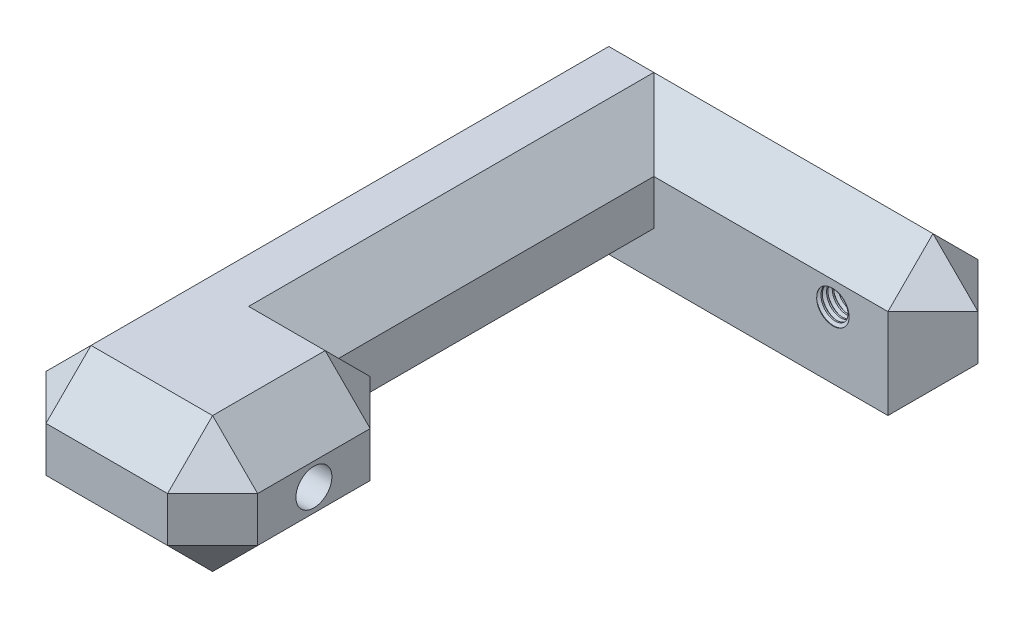
from build123d import *

# Parameters (mm, degrees)
MAIN_BODY_DEPTH    = 15
SKETCH3_R          = 7
CUT_EXTRUDE1_DEPTH = 40
SKETCH4_R          = 4
CUT_EXTRUDE2_DEPTH = 165.05486887
SKETCH6_R          = 3.31
CUT_EXTRUDE3_DEPTH = 144.732390226
THREAD1_PITCH      = 1.25


with BuildPart() as part:
    # Sketch1 → Main Body (new, symmetric)
    with BuildSketch(Plane(origin=(0, 0, 0), x_dir=(1, 0, 0), z_dir=(0, 1, 0))):
        Polygon((0, 0), (0, 45), (-17, 45), (-17, 115), (45, 115), (45, 135), (-47, 135), (-47, 0), align=None)
    extrude(amount=MAIN_BODY_DEPTH, both=True)

    # Sketch3 → Cut-Extrude1 (cut)
    with BuildSketch(Plane.ZY.offset(47)):
        with Locations((-22.5, 0)):
            Circle(SKETCH3_R)
    extrude(amount=-CUT_EXTRUDE1_DEPTH, mode=Mode.SUBTRACT)

    # Sketch4 → Cut-Extrude2 (cut, through all)
    with BuildSketch(Plane.ZY.offset(47)):
        with Locations((-22.5, 0)):
            Circle(SKETCH4_R)
    extrude(amount=-CUT_EXTRUDE2_DEPTH, mode=Mode.SUBTRACT)

    # Sketch6 → Cut-Extrude3 (cut, through all)
    with BuildSketch(Plane(origin=(0, 0, -135), x_dir=(-1, 0, 0), z_dir=(0, 0, -1))):
        with Locations((-22.5, 0)):
            Circle(SKETCH6_R)
    extrude(amount=-CUT_EXTRUDE3_DEPTH, mode=Mode.SUBTRACT)

    # Thread1: the profile of Thread Profile3 profile screwed along a right-hand helix of 17 turns, 8 arcs to a turn; built about Z, then put on its axis
    thread1_z = Axis((0, 0, 0), (0, 0, 1))
    thread1_corners = [(3.3097, 0, -0.000173205), (3.986582344, 0, 0.390624998), (3.986582344, 0, 0.546874998), (3.3097, 0, 0.937673202)]
    with BuildLine(mode=Mode.PRIVATE) as thread1_profile:
        Line(thread1_corners[0], thread1_corners[1])
        Line(thread1_corners[1], thread1_corners[2])
        Line(thread1_corners[2], thread1_corners[3])
        Line(thread1_corners[3], thread1_corners[0])
    thread1_cap = Face(thread1_profile.wire())
    thread1_turn_angles = [0, 22.5, 45, 67.5, 90, 112.5, 135, 157.5, 180, 202.5, 225, 247.5, 270, 292.5, 315, 337.5, 360]
    thread1_turn_weights = [1, 0.9238795325112867, 1, 0.9238795325112867, 1, 0.9238795325112867, 1, 0.9238795325112867, 1, 0.9238795325112867, 1, 0.9238795325112867, 1, 0.9238795325112867, 1, 0.9238795325112867, 1]
    thread1_turn_rails = [Edge.make_bspline([Vector(p[0], p[1], 0).rotate(thread1_z, thread1_turn_angles[k]) / thread1_turn_weights[k] + Vector(0, 0, p[2] + THREAD1_PITCH * thread1_turn_angles[k] / 360) for k in range(17)], [0, 0, 0, 1, 1, 2, 2, 3, 3, 4, 4, 5, 5, 6, 6, 7, 7, 8, 8, 8], 2, thread1_turn_weights) for p in thread1_corners]
    thread1_turn_sides = [Face.make_surface_from_curves(thread1_turn_rails[p[0]], thread1_turn_rails[p[1]]) for p in [(0, 1), (1, 2), (2, 3), (3, 0)]]
    thread1 = Plane(origin=(22.5, 0, -113.75), x_dir=(-1, 0, 0), z_dir=(0, 0, -1)) * Solid(Shell([*[p.moved(Location((0, 0, THREAD1_PITCH * i))) for i in range(17) for p in thread1_turn_sides], thread1_cap, thread1_cap.rotate(thread1_z, 6120).moved(Location((0, 0, THREAD1_PITCH * 6120 / 360)))]))
    add(thread1, mode=Mode.SUBTRACT)

    # Chamfer1
    # the kernel refuses this chamfer: 10 mm, written as the material it takes off along each edge
    with BuildSketch(Plane(origin=(-6.666666667, -8.333333333, -38.333333333), x_dir=(-0.7071067811865475, -0.7071067811865475, 0), z_dir=(0.5773502691896257, -0.5773502691896257, -0.5773502691896257)), Plane(origin=(-40.333333333, -8.333333333, -6.666666667), x_dir=(0, 0.7071067811865472, 0.7071067811865477), z_dir=(-0.5773502691896258, -0.577350269189626, 0.5773502691896255)), Plane(origin=(-6.666666667, 8.333333333, -38.333333333), x_dir=(-0.7071067811865475, 0, -0.7071067811865475), z_dir=(0.5773502691896257, 0.5773502691896257, -0.5773502691896257)), Plane(origin=(-40.333333333, 8.333333333, -128.333333333), x_dir=(-0.7071067811865475, 0, 0.7071067811865475), z_dir=(-0.5773502691896257, 0.5773502691896257, -0.5773502691896257)), Plane(origin=(38.333333333, 8.333333333, -128.333333333), x_dir=(-0.7071067811865475, 0, -0.7071067811865475), z_dir=(0.5773502691896257, 0.5773502691896257, -0.5773502691896257)), Plane(origin=(38.333333333, 8.333333333, -121.666666667), x_dir=(-0.7071067811865475, 0.7071067811865475, 0), z_dir=(0.5773502691896257, 0.5773502691896257, 0.5773502691896257))) as chamfer1_piece_1:
        Polygon((-7.071067812, -4.082482905), (7.071067812, -4.082482905), (0, 8.164965809), align=None)
    extrude(amount=12.701705922, mode=Mode.SUBTRACT)
    with BuildSketch(Plane(origin=(-6.666666667, -8.333333333, -6.666666667), x_dir=(-0.7071067811865475, -0.7071067811865475, 0), z_dir=(0.5773502691896257, -0.5773502691896257, 0.5773502691896257)), Plane(origin=(-40.333333333, 8.333333333, -6.666666667), x_dir=(-0.7071067811865475, 0, -0.7071067811865477), z_dir=(-0.5773502691896258, 0.5773502691896258, 0.5773502691896257)), Plane(origin=(-6.666666667, 8.333333333, -6.666666667), x_dir=(-0.7071067811865475, 0, 0.7071067811865475), z_dir=(0.5773502691896257, 0.5773502691896257, 0.5773502691896257))) as chamfer1_piece_2:
        Polygon((-7.071067812, 4.082482905), (7.071067812, 4.082482905), (0, -8.164965809), align=None)
    extrude(amount=12.701705922, mode=Mode.SUBTRACT)
    with BuildSketch(Plane(origin=(-17, -15, -45), x_dir=(-0.9996219169112968, -0.027495876610586317, 0), z_dir=(0, 0, -1))) as chamfer1_piece_3:
        with BuildLine():
            Line((10.286731952, 0), (-0.565471549, 10.271177935))
            Line((-0.565471549, 10.271177935), (-0.765395932, 10.26567876))
            ThreePointArc((-0.765395932, 10.26567876), (-0.341292271, 5.133978296), (-0.199924383, -0.005499175))
            Line((-0.199924383, -0.005499175), (0.005499175, -0.199924383))
            ThreePointArc((0.005499175, -0.199924383), (5.144976647, -0.058556496), (10.292231127, -0.199924383))
            Line((10.292231127, -0.199924383), (10.286731952, 0))
        make_face()
    extrude(amount=70, mode=Mode.SUBTRACT)
    with BuildSketch(Plane(origin=(25.71682988, -15, -45), x_dir=(0, -0.027495876610586317, 0.9996219169112968), z_dir=(-1, 0, 0)), Plane(origin=(25.71682988, 15, -45), x_dir=(0, -0.9996219169112968, -0.027495876610586317), z_dir=(-1, 0, 0))) as chamfer1_piece_4:
        with BuildLine():
            Line((10.286731952, 0), (-0.565471549, 10.271177935))
            Line((-0.565471549, 10.271177935), (-0.765395932, 10.26567876))
            ThreePointArc((-0.765395932, 10.26567876), (-0.341292271, 5.133978296), (-0.199924383, -0.005499175))
            Line((-0.199924383, -0.005499175), (0.005499175, -0.199924383))
            ThreePointArc((0.005499175, -0.199924383), (5.144976647, -0.058556496), (10.292231127, -0.199924383))
            Line((10.292231127, -0.199924383), (10.286731952, 0))
        make_face()
    extrude(amount=42.71682988, mode=Mode.SUBTRACT)
    with BuildSketch(Plane(origin=(0, -15, 25.71682988), x_dir=(0.027495876610586372, 0.9996219169112968, 0), z_dir=(0, 0, -1))) as chamfer1_piece_5:
        with BuildLine():
            Line((10.286731952, 0), (-0.565471549, -10.271177935))
            Line((-0.565471549, -10.271177935), (-0.765395932, -10.26567876))
            ThreePointArc((-0.765395932, -10.26567876), (-0.341292271, -5.133978296), (-0.199924383, 0.005499175))
            Line((-0.199924383, 0.005499175), (0.005499175, 0.199924383))
            ThreePointArc((0.005499175, 0.199924383), (5.144976647, 0.058556496), (10.292231127, 0.199924383))
            Line((10.292231127, 0.199924383), (10.286731952, 0))
        make_face()
    extrude(amount=96.433659759, mode=Mode.SUBTRACT)
    with BuildSketch(Plane(origin=(-72.71682988, -15, 0), x_dir=(0, -0.027495876610586317, -0.9996219169112968), z_dir=(1, 0, 0)), Plane(origin=(-72.71682988, 15, 0), x_dir=(0, -0.9996219169112968, 0.027495876610586365), z_dir=(1, 0, 0))) as chamfer1_piece_6:
        with BuildLine():
            Line((10.286731952, 0), (-0.565471549, 10.271177935))
            Line((-0.565471549, 10.271177935), (-0.765395932, 10.26567876))
            ThreePointArc((-0.765395932, 10.26567876), (-0.341292271, 5.133978296), (-0.199924383, -0.005499175))
            Line((-0.199924383, -0.005499175), (0.005499175, -0.199924383))
            ThreePointArc((0.005499175, -0.199924383), (5.144976647, -0.058556496), (10.292231127, -0.199924383))
            Line((10.292231127, -0.199924383), (10.286731952, 0))
        make_face()
    extrude(amount=98.433659759, mode=Mode.SUBTRACT)
    with BuildSketch(Plane(origin=(-47, 40.71682988, 0), x_dir=(0.9996219169112968, 0, 0.027495876610586258), z_dir=(0, -1, 0)), Plane(origin=(45, -40.71682988, -135), x_dir=(0.027495876610586317, 0, 0.9996219169112968), z_dir=(0, 1, 0)), Plane(origin=(45, -40.71682988, -115), x_dir=(-0.9996219169112968, 0, 0.027495876610586317), z_dir=(0, 1, 0)), Plane(origin=(0, -40.71682988, -45), x_dir=(0.027495876610586372, 0, 0.9996219169112968), z_dir=(0, 1, 0)), Plane(origin=(0, 40.71682988, 0), x_dir=(0.027495876610586372, 0, -0.9996219169112968), z_dir=(0, -1, 0))) as chamfer1_piece_7:
        with BuildLine():
            Line((10.286731952, 0), (-0.565471549, -10.271177935))
            Line((-0.565471549, -10.271177935), (-0.765395932, -10.26567876))
            ThreePointArc((-0.765395932, -10.26567876), (-0.341292271, -5.133978296), (-0.199924383, 0.005499175))
            Line((-0.199924383, 0.005499175), (0.005499175, 0.199924383))
            ThreePointArc((0.005499175, 0.199924383), (5.144976647, 0.058556496), (10.292231127, 0.199924383))
            Line((10.292231127, 0.199924383), (10.286731952, 0))
        make_face()
    extrude(amount=81.433659759, mode=Mode.SUBTRACT)
    with BuildSketch(Plane(origin=(-47, 40.71682988, -135), x_dir=(0.9996219169112968, 0, -0.0274958766105877), z_dir=(0, -1, 0))) as chamfer1_piece_8:
        with BuildLine():
            Line((10.286731952, 0), (-0.565471549, 10.271177935))
            Line((-0.565471549, 10.271177935), (-0.765395932, 10.26567876))
            ThreePointArc((-0.765395932, 10.26567876), (-0.341292271, 5.133978296), (-0.199924383, -0.005499175))
            Line((-0.199924383, -0.005499175), (0.005499175, -0.199924383))
            ThreePointArc((0.005499175, -0.199924383), (5.144976647, -0.058556496), (10.292231127, -0.199924383))
            Line((10.292231127, -0.199924383), (10.286731952, 0))
        make_face()
    extrude(amount=81.433659759, mode=Mode.SUBTRACT)
    with BuildSketch(Plane(origin=(-17, 15, -45), x_dir=(-0.9996219169112968, 0.027495876610586317, 0), z_dir=(0, 0, -1))) as chamfer1_piece_9:
        with BuildLine():
            Line((10.286731952, 0), (-0.565471549, -10.271177935))
            Line((-0.565471549, -10.271177935), (-0.765395932, -10.26567876))
            ThreePointArc((-0.765395932, -10.26567876), (-0.341292271, -5.133978296), (-0.199924383, 0.005499175))
            Line((-0.199924383, 0.005499175), (0.005499175, 0.199924383))
            ThreePointArc((0.005499175, 0.199924383), (5.144976647, 0.058556496), (10.292231127, 0.199924383))
            Line((10.292231127, 0.199924383), (10.286731952, 0))
        make_face()
    extrude(amount=70, mode=Mode.SUBTRACT)
    with BuildSketch(Plane(origin=(-17, 15, -115), x_dir=(0, 0.027495876610586317, -0.9996219169112968), z_dir=(1, 0, 0))) as chamfer1_piece_10:
        with BuildLine():
            Line((10.286731952, 0), (-0.565471549, -10.271177935))
            Line((-0.565471549, -10.271177935), (-0.765395932, -10.26567876))
            ThreePointArc((-0.765395932, -10.26567876), (-0.341292271, -5.133978296), (-0.199924383, 0.005499175))
            Line((-0.199924383, 0.005499175), (0.005499175, 0.199924383))
            ThreePointArc((0.005499175, 0.199924383), (5.144976647, 0.058556496), (10.292231127, 0.199924383))
            Line((10.292231127, 0.199924383), (10.286731952, 0))
        make_face()
    extrude(amount=87.71682988, mode=Mode.SUBTRACT)
    with BuildSketch(Plane(origin=(45, 15, -89.28317012), x_dir=(-0.9996219169112968, 0.027495876610586317, 0), z_dir=(0, 0, -1))) as chamfer1_piece_11:
        with BuildLine():
            Line((10.286731952, 0), (-0.565471549, -10.271177935))
            Line((-0.565471549, -10.271177935), (-0.765395932, -10.26567876))
            ThreePointArc((-0.765395932, -10.26567876), (-0.341292271, -5.133978296), (-0.199924383, 0.005499175))
            Line((-0.199924383, 0.005499175), (0.005499175, 0.199924383))
            ThreePointArc((0.005499175, 0.199924383), (5.144976647, 0.058556496), (10.292231127, 0.199924383))
            Line((10.292231127, 0.199924383), (10.286731952, 0))
        make_face()
    extrude(amount=71.433659759, mode=Mode.SUBTRACT)
    with BuildSketch(Plane(origin=(70.71682988, 15, -135), x_dir=(0, 0.027495876610586317, 0.9996219169112968), z_dir=(-1, 0, 0))) as chamfer1_piece_12:
        with BuildLine():
            Line((10.286731952, 0), (-0.565471549, -10.271177935))
            Line((-0.565471549, -10.271177935), (-0.765395932, -10.26567876))
            ThreePointArc((-0.765395932, -10.26567876), (-0.341292271, -5.133978296), (-0.199924383, 0.005499175))
            Line((-0.199924383, 0.005499175), (0.005499175, 0.199924383))
            ThreePointArc((0.005499175, 0.199924383), (5.144976647, 0.058556496), (10.292231127, 0.199924383))
            Line((10.292231127, 0.199924383), (10.286731952, 0))
        make_face()
    extrude(amount=143.433659759, mode=Mode.SUBTRACT)
    with BuildSketch(Plane(origin=(-47, 15, -160.71682988), x_dir=(0.9996219169112968, 0.027495876610586317, 0), z_dir=(0, 0, 1))) as chamfer1_piece_13:
        with BuildLine():
            Line((10.286731952, 0), (-0.565471549, -10.271177935))
            Line((-0.565471549, -10.271177935), (-0.765395932, -10.26567876))
            ThreePointArc((-0.765395932, -10.26567876), (-0.341292271, -5.133978296), (-0.199924383, 0.005499175))
            Line((-0.199924383, 0.005499175), (0.005499175, 0.199924383))
            ThreePointArc((0.005499175, 0.199924383), (5.144976647, 0.058556496), (10.292231127, 0.199924383))
            Line((10.292231127, 0.199924383), (10.286731952, 0))
        make_face()
    extrude(amount=186.433659759, mode=Mode.SUBTRACT)
    with BuildSketch(Plane(origin=(-47, -15, -160.71682988), x_dir=(0.9996219169112968, -0.027495876610586317, 0), z_dir=(0, 0, 1))) as chamfer1_piece_14:
        with BuildLine():
            Line((10.286731952, 0), (-0.565471549, 10.271177935))
            Line((-0.565471549, 10.271177935), (-0.765395932, 10.26567876))
            ThreePointArc((-0.765395932, 10.26567876), (-0.341292271, 5.133978296), (-0.199924383, -0.005499175))
            Line((-0.199924383, -0.005499175), (0.005499175, -0.199924383))
            ThreePointArc((0.005499175, -0.199924383), (5.144976647, -0.058556496), (10.292231127, -0.199924383))
            Line((10.292231127, -0.199924383), (10.286731952, 0))
        make_face()
    extrude(amount=186.433659759, mode=Mode.SUBTRACT)
    with BuildSketch(Plane(origin=(0, 15, 25.71682988), x_dir=(0.027495876610586372, -0.9996219169112968, 0), z_dir=(0, 0, -1))) as chamfer1_piece_15:
        with BuildLine():
            Line((10.286731952, 0), (-0.565471549, 10.271177935))
            Line((-0.565471549, 10.271177935), (-0.765395932, 10.26567876))
            ThreePointArc((-0.765395932, 10.26567876), (-0.341292271, 5.133978296), (-0.199924383, -0.005499175))
            Line((-0.199924383, -0.005499175), (0.005499175, -0.199924383))
            ThreePointArc((0.005499175, -0.199924383), (5.144976647, -0.058556496), (10.292231127, -0.199924383))
            Line((10.292231127, -0.199924383), (10.286731952, 0))
        make_face()
    extrude(amount=96.433659759, mode=Mode.SUBTRACT)
    with BuildSketch(Plane(origin=(45, -15, -89.28317012), x_dir=(-0.9996219169112968, -0.027495876610586317, 0), z_dir=(0, 0, -1))) as chamfer1_piece_16:
        with BuildLine():
            Line((10.286731952, 0), (-0.565471549, 10.271177935))
            Line((-0.565471549, 10.271177935), (-0.765395932, 10.26567876))
            ThreePointArc((-0.765395932, 10.26567876), (-0.341292271, 5.133978296), (-0.199924383, -0.005499175))
            Line((-0.199924383, -0.005499175), (0.005499175, -0.199924383))
            ThreePointArc((0.005499175, -0.199924383), (5.144976647, -0.058556496), (10.292231127, -0.199924383))
            Line((10.292231127, -0.199924383), (10.286731952, 0))
        make_face()
    extrude(amount=71.433659759, mode=Mode.SUBTRACT)
    with BuildSketch(Plane(origin=(25.71682988, -15, -45), x_dir=(0, -0.027495876610586317, 0.9996219169112968), z_dir=(-1, 0, 0))) as chamfer1_piece_17a_section:
        with BuildLine():
            Line((10.286731952, 0), (-0.565471549, 10.271177935))
            Line((-0.565471549, 10.271177935), (-0.765395932, 10.26567876))
            ThreePointArc((-0.765395932, 10.26567876), (-0.341292271, 5.133978296), (-0.199924383, -0.005499175))
            Line((-0.199924383, -0.005499175), (0.005499175, -0.199924383))
            ThreePointArc((0.005499175, -0.199924383), (5.144976647, -0.058556496), (10.292231127, -0.199924383))
            Line((10.292231127, -0.199924383), (10.286731952, 0))
        make_face()
    chamfer1_piece_17a = extrude(amount=68.433659759, mode=Mode.PRIVATE)
    chamfer1_piece_17a = split(chamfer1_piece_17a, bisect_by=Plane(origin=(-17, -11.702063732, -41.702063732), z_dir=(-1, 0, 0)), keep=Keep.TOP, mode=Mode.PRIVATE)
    with BuildSketch(Plane(origin=(-17, -15, -19.28317012), x_dir=(-0.9996219169112968, -0.027495876610586317, 0), z_dir=(0, 0, -1))) as chamfer1_piece_17b_section:
        with BuildLine():
            Line((10.286731952, 0), (-0.565471549, 10.271177935))
            Line((-0.565471549, 10.271177935), (-0.765395932, 10.26567876))
            ThreePointArc((-0.765395932, 10.26567876), (-0.341292271, 5.133978296), (-0.199924383, -0.005499175))
            Line((-0.199924383, -0.005499175), (0.005499175, -0.199924383))
            ThreePointArc((0.005499175, -0.199924383), (5.144976647, -0.058556496), (10.292231127, -0.199924383))
            Line((10.292231127, -0.199924383), (10.286731952, 0))
        make_face()
    chamfer1_piece_17b = extrude(amount=95.71682988, mode=Mode.PRIVATE)
    chamfer1_piece_17b = split(chamfer1_piece_17b, bisect_by=Plane(origin=(-20.297936268, -11.702063732, -45), z_dir=(0, 0, 1)), keep=Keep.TOP, mode=Mode.PRIVATE)
    chamfer1_piece_17 = chamfer1_piece_17a & chamfer1_piece_17b
    add(chamfer1_piece_17, mode=Mode.SUBTRACT)
    with BuildSketch(Plane(origin=(25.71682988, 15, -45), x_dir=(0, -0.9996219169112968, -0.027495876610586317), z_dir=(-1, 0, 0))) as chamfer1_piece_18a_section:
        with BuildLine():
            Line((10.286731952, 0), (-0.565471549, 10.271177935))
            Line((-0.565471549, 10.271177935), (-0.765395932, 10.26567876))
            ThreePointArc((-0.765395932, 10.26567876), (-0.341292271, 5.133978296), (-0.199924383, -0.005499175))
            Line((-0.199924383, -0.005499175), (0.005499175, -0.199924383))
            ThreePointArc((0.005499175, -0.199924383), (5.144976647, -0.058556496), (10.292231127, -0.199924383))
            Line((10.292231127, -0.199924383), (10.286731952, 0))
        make_face()
    chamfer1_piece_18a = extrude(amount=68.433659759, mode=Mode.PRIVATE)
    chamfer1_piece_18a = split(chamfer1_piece_18a, bisect_by=Plane(origin=(-17, 11.702063732, -41.702063732), z_dir=(-1, 0, 0)), keep=Keep.TOP, mode=Mode.PRIVATE)
    with BuildSketch(Plane(origin=(-17, 15, -19.28317012), x_dir=(-0.9996219169112968, 0.027495876610586317, 0), z_dir=(0, 0, -1))) as chamfer1_piece_18b_section:
        with BuildLine():
            Line((10.286731952, 0), (-0.565471549, -10.271177935))
            Line((-0.565471549, -10.271177935), (-0.765395932, -10.26567876))
            ThreePointArc((-0.765395932, -10.26567876), (-0.341292271, -5.133978296), (-0.199924383, 0.005499175))
            Line((-0.199924383, 0.005499175), (0.005499175, 0.199924383))
            ThreePointArc((0.005499175, 0.199924383), (5.144976647, 0.058556496), (10.292231127, 0.199924383))
            Line((10.292231127, 0.199924383), (10.286731952, 0))
        make_face()
    chamfer1_piece_18b = extrude(amount=95.71682988, mode=Mode.PRIVATE)
    chamfer1_piece_18b = split(chamfer1_piece_18b, bisect_by=Plane(origin=(-20.297936268, 11.702063732, -45), z_dir=(0, 0, 1)), keep=Keep.TOP, mode=Mode.PRIVATE)
    chamfer1_piece_18 = chamfer1_piece_18a & chamfer1_piece_18b
    add(chamfer1_piece_18, mode=Mode.SUBTRACT)
    with BuildSketch(Plane(origin=(-17, 15, -45), x_dir=(-0.9996219169112968, 0.027495876610586317, 0), z_dir=(0, 0, -1))) as chamfer1_piece_19a_section:
        with BuildLine():
            Line((10.286731952, 0), (-0.565471549, -10.271177935))
            Line((-0.565471549, -10.271177935), (-0.765395932, -10.26567876))
            ThreePointArc((-0.765395932, -10.26567876), (-0.341292271, -5.133978296), (-0.199924383, 0.005499175))
            Line((-0.199924383, 0.005499175), (0.005499175, 0.199924383))
            ThreePointArc((0.005499175, 0.199924383), (5.144976647, 0.058556496), (10.292231127, 0.199924383))
            Line((10.292231127, 0.199924383), (10.286731952, 0))
        make_face()
    chamfer1_piece_19a = extrude(amount=95.71682988, mode=Mode.PRIVATE)
    chamfer1_piece_19a = split(chamfer1_piece_19a, bisect_by=Plane(origin=(-20.297936268, 11.702063732, -115), z_dir=(0, 0, -1)), keep=Keep.TOP, mode=Mode.PRIVATE)
    with BuildSketch(Plane(origin=(-42.71682988, 15, -115), x_dir=(0, 0.027495876610586317, -0.9996219169112968), z_dir=(1, 0, 0))) as chamfer1_piece_19b_section:
        with BuildLine():
            Line((10.286731952, 0), (-0.565471549, -10.271177935))
            Line((-0.565471549, -10.271177935), (-0.765395932, -10.26567876))
            ThreePointArc((-0.765395932, -10.26567876), (-0.341292271, -5.133978296), (-0.199924383, 0.005499175))
            Line((-0.199924383, 0.005499175), (0.005499175, 0.199924383))
            ThreePointArc((0.005499175, 0.199924383), (5.144976647, 0.058556496), (10.292231127, 0.199924383))
            Line((10.292231127, 0.199924383), (10.286731952, 0))
        make_face()
    chamfer1_piece_19b = extrude(amount=113.433659759, mode=Mode.PRIVATE)
    chamfer1_piece_19b = split(chamfer1_piece_19b, bisect_by=Plane(origin=(-17, 11.702063732, -118.297936268), z_dir=(-1, 0, 0)), keep=Keep.TOP, mode=Mode.PRIVATE)
    chamfer1_piece_19 = chamfer1_piece_19a & chamfer1_piece_19b
    add(chamfer1_piece_19, mode=Mode.SUBTRACT)


solid = part.part
